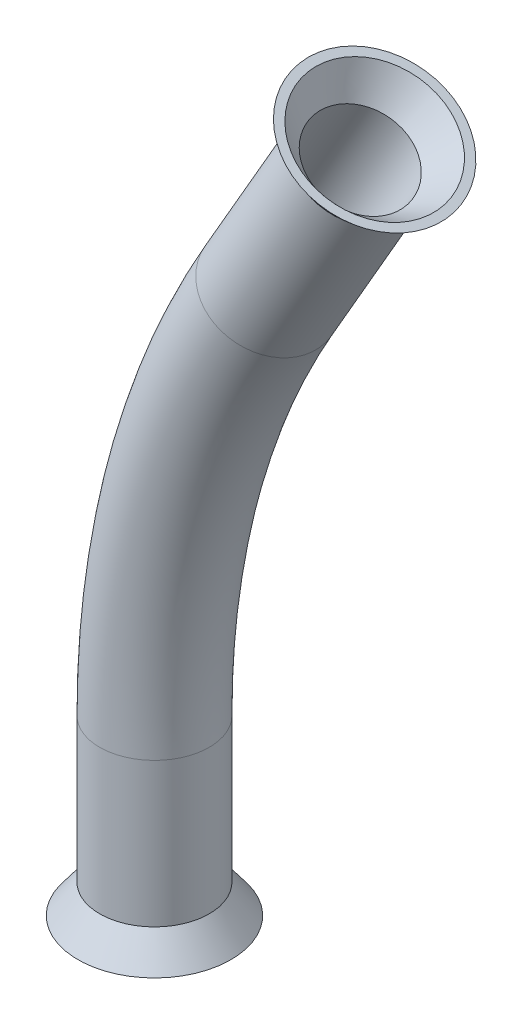
from build123d import *

# Parameters (mm, degrees)
SKETCH1_R           = 4.826
SKETCH1_R_2         = 4.064
SKETCH3_R           = 4.826
BOSS_EXTRUDE1_DEPTH = 2.54
BOSS_EXTRUDE1_DRAFT = -37
SKETCH5_R           = 4.826
BOSS_EXTRUDE2_DEPTH = 2.54
BOSS_EXTRUDE2_DRAFT = -37


with BuildPart() as part:
    # Sweep1: sweep along a path in Sketch2
    with BuildLine(Plane.XY) as sweep1_path:
        Line((0, 0), (0, 12.7))
        ThreePointArc((0, 12.7), (2.549187543, 32.063001763), (10.023027253, 50.106446956))
        Line((10.023027253, 50.106446956), (18.12241613, 64.135))
    # Sketch1 → Sweep1 (sweep)
    with BuildSketch(Plane(origin=(0, 0, 0), x_dir=(1, 0, 0), z_dir=(0, 1, 0))):
        Circle(SKETCH1_R)
        Circle(SKETCH1_R_2, mode=Mode.SUBTRACT)
    sweep(path=sweep1_path.line)


with BuildPart() as boss_extrude1_tool:
    # Sketch3 → Boss-Extrude1 (with draft: the straight prism first)
    with BuildSketch(Plane.XZ):
        Circle(SKETCH3_R)
    extrude(amount=BOSS_EXTRUDE1_DEPTH)
    # Boss-Extrude1: the draft: its side faces are tilted about the plane it starts from
    boss_extrude1_sides = [boss_extrude1_tool.faces().sort_by_distance(p)[0] for p in [
        (-4.826, -1.27, 0),
    ]]
    draft(boss_extrude1_sides, Plane.XZ, BOSS_EXTRUDE1_DRAFT)


with BuildPart() as part_1:
    add(part.part)

    # Boss-Extrude1: add boss_extrude1_tool
    add(boss_extrude1_tool.part)

    # Cut-Extrude1 cone 1 section (through the dimple's axis) → Cut-Extrude1 (revolve, cut)
    with BuildSketch(Plane(origin=(0, -2.54, 0), x_dir=(0, 0, -1), z_dir=(1, 0, 0))):
        Polygon((0, 0), (5.978027287, 0), (0, 7.933110155), align=None)
    revolve(axis=Axis((0, -2.54, 0), (0, 1, 0)), mode=Mode.SUBTRACT)


with BuildPart() as boss_extrude2_tool:
    # Sketch5 → Boss-Extrude2 (with draft: the straight prism first)
    with BuildSketch(Plane(origin=(32.301873668, 55.948486373, 0), x_dir=(0, 0, -1), z_dir=(0.5000000000000008, 0.8660254037844382, 0))):
        with Locations((0, 16.373027253)):
            Circle(SKETCH5_R)
    extrude(amount=BOSS_EXTRUDE2_DEPTH)
    # Boss-Extrude2: the draft: its side faces are tilted about the plane it starts from
    boss_extrude2_sides = [boss_extrude2_tool.faces().sort_by_distance(p)[0] for p in [
        (18.75741613, 65.234852263, 4.826),
    ]]
    draft(boss_extrude2_sides, Plane(origin=(32.301873668, 55.948486373, 0), x_dir=(0, 0, -1), z_dir=(0.5000000000000008, 0.8660254037844382, 0)), BOSS_EXTRUDE2_DRAFT)


with BuildPart() as part_2:
    add(part_1.part)

    # Boss-Extrude2: add boss_extrude2_tool
    add(boss_extrude2_tool.part)

    # Cut-Extrude2 cone 1 section (through the dimple's axis) → Cut-Extrude2 (revolve, cut)
    with BuildSketch(Plane(origin=(19.39241613, 66.334704526, 0), x_dir=(0, 0, 1), z_dir=(0.866025404, -0.5, 0))):
        Polygon((0, 0), (5.978027287, 0), (0, 7.933110155), align=None)
    revolve(axis=Axis((19.39241613, 66.334704526, 0), (-0.5, -0.866025404, 0)), mode=Mode.SUBTRACT)


solid = part_2.part
